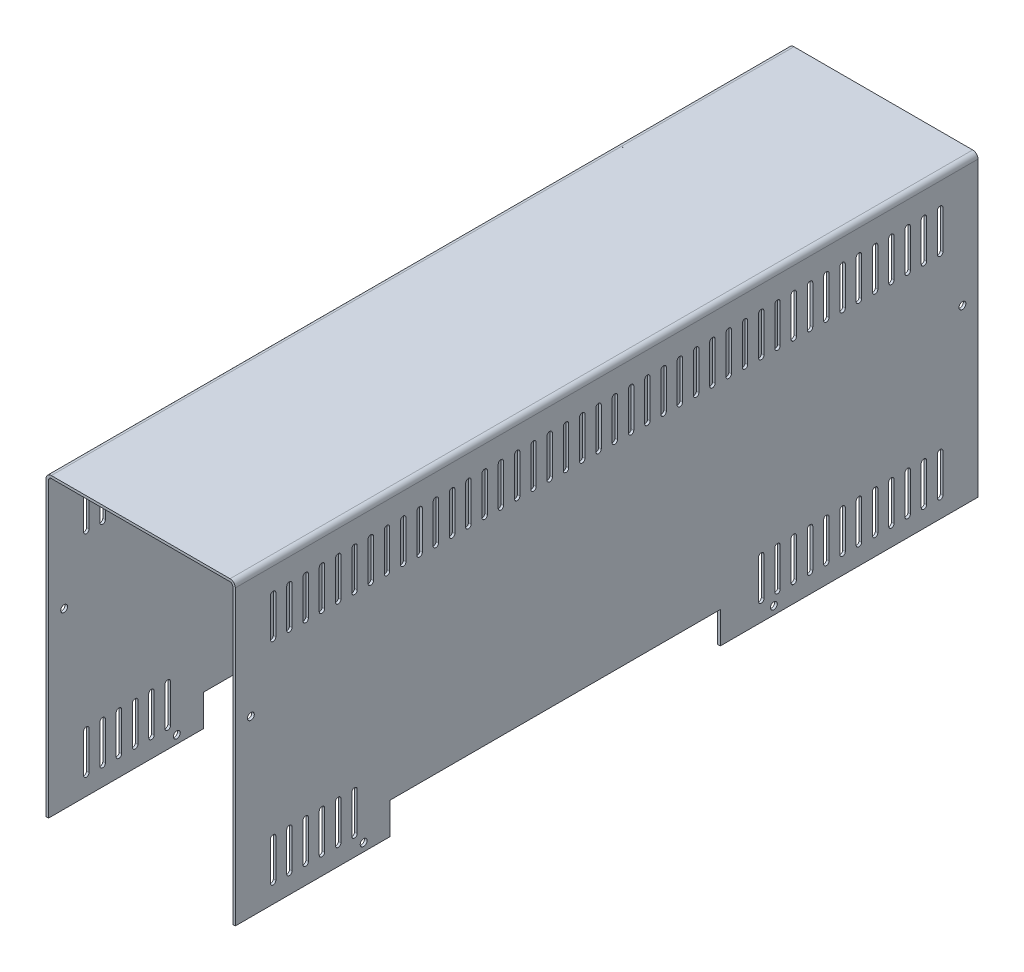
from build123d import *

# Parameters (mm, degrees)
BASE_FLANGE1_DEPTH      = 425.49
SKETCH6_W               = 193.4
SKETCH6_H               = 18.5
CUT_EXTRUDE1_DEPTH      = 473.550695799
CUT_EXTRUDE2_DEPTH      = 473.550695799
CUT_EXTRUDE2_DEPTH_BACK = 473.550695799
SKETCH7_R               = 2
CUT_EXTRUDE3_DEPTH      = 473.550695799
BOSS_EXTRUDE1_DEPTH     = 4.76
BOSS_EXTRUDE2_START     = 4.76
BOSS_EXTRUDE2_DEPTH     = 4.76


# Sheet-metal steps are written as plain solids
with BuildPart() as part:
    # Sketch1 → Base-Flange1 (new body)
    with BuildSketch(Plane.XY):
        with BuildLine():
            Line((0, -173.1), (0, -1.6))
            ThreePointArc((0, -1.6), (0.46862915, -0.46862915), (1.6, 0))
            Line((1.6, 0), (106.3, 0))
            ThreePointArc((106.3, 0), (107.43137085, -0.46862915), (107.9, -1.6))
            Line((107.9, -1.6), (107.9, -173.1))
            Line((107.9, -173.1), (109.4, -173.1))
            Line((109.4, -173.1), (109.4, -1.6))
            ThreePointArc((109.4, -1.6), (108.492031022, 0.592031022), (106.3, 1.5))
            Line((106.3, 1.5), (1.6, 1.5))
            ThreePointArc((1.6, 1.5), (-0.592031022, 0.592031022), (-1.5, -1.6))
            Line((-1.5, -1.6), (-1.5, -173.1))
            Line((-1.5, -173.1), (0, -173.1))
        make_face()
    extrude(amount=-BASE_FLANGE1_DEPTH)

    # Sketch6 → Cut-Extrude1 (cut, through all)
    with BuildSketch(Plane(origin=(109.4, 0, 0), x_dir=(0, 0, -1), z_dir=(1, 0, 0))):
        with Locations((182.6, -163.85)):
            Rectangle(SKETCH6_W, SKETCH6_H)
    extrude(amount=-CUT_EXTRUDE1_DEPTH, mode=Mode.SUBTRACT)

    # Sketch7 → Cut-Extrude2 (cut, two sides: drawn at the far end of the back side and taken through both)
    with BuildSketch(Plane(origin=(109.4, 0, 0), x_dir=(0, 0, -1), z_dir=(1, 0, 0)).offset(-CUT_EXTRUDE2_DEPTH_BACK)):
        with Locations(Location((421.14, -71.34, 0), (0, 0, 90))):
            Circle(SKETCH7_R)
        with Locations(Location((310.68, -168.38, 0), (0, 0, 90))):
            Circle(SKETCH7_R)
        with Locations(Location((70.39, -168.38, 0), (0, 0, 90))):
            Circle(SKETCH7_R)
        with Locations(Location((4.35, -71.34, 0), (0, 0, 90))):
            Circle(SKETCH7_R)
    extrude(amount=CUT_EXTRUDE2_DEPTH + CUT_EXTRUDE2_DEPTH_BACK, mode=Mode.SUBTRACT)

    # Sketch8 → Cut-Extrude3 (cut, through all)
    with BuildSketch(Plane(origin=(109.4, 0, 0), x_dir=(0, 0, -1), z_dir=(1, 0, 0))):
        with BuildLine():
            Line((18.975, -15.8875), (18.975, -38.2925))
            ThreePointArc((18.975, -38.2925), (17.3875, -39.88), (15.8, -38.2925))
            Line((15.8, -38.2925), (15.8, -15.8875))
            ThreePointArc((15.8, -15.8875), (17.3875, -14.3), (18.975, -15.8875))
        make_face()
        with BuildLine():
            Line((28.505, -15.8875), (28.505, -38.2925))
            ThreePointArc((28.505, -38.2925), (26.9175, -39.88), (25.33, -38.2925))
            Line((25.33, -38.2925), (25.33, -15.8875))
            ThreePointArc((25.33, -15.8875), (26.9175, -14.3), (28.505, -15.8875))
        make_face()
        with BuildLine():
            Line((38.035, -15.8875), (38.035, -38.2925))
            ThreePointArc((38.035, -38.2925), (36.4475, -39.88), (34.86, -38.2925))
            Line((34.86, -38.2925), (34.86, -15.8875))
            ThreePointArc((34.86, -15.8875), (36.4475, -14.3), (38.035, -15.8875))
        make_face()
        with BuildLine():
            Line((47.565, -15.8875), (47.565, -38.2925))
            ThreePointArc((47.565, -38.2925), (45.9775, -39.88), (44.39, -38.2925))
            Line((44.39, -38.2925), (44.39, -15.8875))
            ThreePointArc((44.39, -15.8875), (45.9775, -14.3), (47.565, -15.8875))
        make_face()
        with BuildLine():
            Line((57.095, -15.8875), (57.095, -38.2925))
            ThreePointArc((57.095, -38.2925), (55.5075, -39.88), (53.92, -38.2925))
            Line((53.92, -38.2925), (53.92, -15.8875))
            ThreePointArc((53.92, -15.8875), (55.5075, -14.3), (57.095, -15.8875))
        make_face()
        with BuildLine():
            Line((66.625, -15.8875), (66.625, -38.2925))
            ThreePointArc((66.625, -38.2925), (65.0375, -39.88), (63.45, -38.2925))
            Line((63.45, -38.2925), (63.45, -15.8875))
            ThreePointArc((63.45, -15.8875), (65.0375, -14.3), (66.625, -15.8875))
        make_face()
        with BuildLine():
            Line((76.155, -15.8875), (76.155, -38.2925))
            ThreePointArc((76.155, -38.2925), (74.5675, -39.88), (72.98, -38.2925))
            Line((72.98, -38.2925), (72.98, -15.8875))
            ThreePointArc((72.98, -15.8875), (74.5675, -14.3), (76.155, -15.8875))
        make_face()
        with BuildLine():
            Line((85.685, -15.8875), (85.685, -38.2925))
            ThreePointArc((85.685, -38.2925), (84.0975, -39.88), (82.51, -38.2925))
            Line((82.51, -38.2925), (82.51, -15.8875))
            ThreePointArc((82.51, -15.8875), (84.0975, -14.3), (85.685, -15.8875))
        make_face()
        with BuildLine():
            Line((95.215, -15.8875), (95.215, -38.2925))
            ThreePointArc((95.215, -38.2925), (93.6275, -39.88), (92.04, -38.2925))
            Line((92.04, -38.2925), (92.04, -15.8875))
            ThreePointArc((92.04, -15.8875), (93.6275, -14.3), (95.215, -15.8875))
        make_face()
        with BuildLine():
            Line((104.745, -15.8875), (104.745, -38.2925))
            ThreePointArc((104.745, -38.2925), (103.1575, -39.88), (101.57, -38.2925))
            Line((101.57, -38.2925), (101.57, -15.8875))
            ThreePointArc((101.57, -15.8875), (103.1575, -14.3), (104.745, -15.8875))
        make_face()
        with BuildLine():
            Line((114.275, -15.8875), (114.275, -38.2925))
            ThreePointArc((114.275, -38.2925), (112.6875, -39.88), (111.1, -38.2925))
            Line((111.1, -38.2925), (111.1, -15.8875))
            ThreePointArc((111.1, -15.8875), (112.6875, -14.3), (114.275, -15.8875))
        make_face()
        with BuildLine():
            Line((123.805, -15.8875), (123.805, -38.2925))
            ThreePointArc((123.805, -38.2925), (122.2175, -39.88), (120.63, -38.2925))
            Line((120.63, -38.2925), (120.63, -15.8875))
            ThreePointArc((120.63, -15.8875), (122.2175, -14.3), (123.805, -15.8875))
        make_face()
        with BuildLine():
            Line((133.335, -15.8875), (133.335, -38.2925))
            ThreePointArc((133.335, -38.2925), (131.7475, -39.88), (130.16, -38.2925))
            Line((130.16, -38.2925), (130.16, -15.8875))
            ThreePointArc((130.16, -15.8875), (131.7475, -14.3), (133.335, -15.8875))
        make_face()
        with BuildLine():
            Line((142.865, -15.8875), (142.865, -38.2925))
            ThreePointArc((142.865, -38.2925), (141.2775, -39.88), (139.69, -38.2925))
            Line((139.69, -38.2925), (139.69, -15.8875))
            ThreePointArc((139.69, -15.8875), (141.2775, -14.3), (142.865, -15.8875))
        make_face()
        with BuildLine():
            Line((152.395, -15.8875), (152.395, -38.2925))
            ThreePointArc((152.395, -38.2925), (150.8075, -39.88), (149.22, -38.2925))
            Line((149.22, -38.2925), (149.22, -15.8875))
            ThreePointArc((149.22, -15.8875), (150.8075, -14.3), (152.395, -15.8875))
        make_face()
        with BuildLine():
            Line((161.925, -15.8875), (161.925, -38.2925))
            ThreePointArc((161.925, -38.2925), (160.3375, -39.88), (158.75, -38.2925))
            Line((158.75, -38.2925), (158.75, -15.8875))
            ThreePointArc((158.75, -15.8875), (160.3375, -14.3), (161.925, -15.8875))
        make_face()
        with BuildLine():
            Line((171.455, -15.8875), (171.455, -38.2925))
            ThreePointArc((171.455, -38.2925), (169.8675, -39.88), (168.28, -38.2925))
            Line((168.28, -38.2925), (168.28, -15.8875))
            ThreePointArc((168.28, -15.8875), (169.8675, -14.3), (171.455, -15.8875))
        make_face()
        with BuildLine():
            Line((180.985, -15.8875), (180.985, -38.2925))
            ThreePointArc((180.985, -38.2925), (179.3975, -39.88), (177.81, -38.2925))
            Line((177.81, -38.2925), (177.81, -15.8875))
            ThreePointArc((177.81, -15.8875), (179.3975, -14.3), (180.985, -15.8875))
        make_face()
        with BuildLine():
            Line((190.515, -15.8875), (190.515, -38.2925))
            ThreePointArc((190.515, -38.2925), (188.9275, -39.88), (187.34, -38.2925))
            Line((187.34, -38.2925), (187.34, -15.8875))
            ThreePointArc((187.34, -15.8875), (188.9275, -14.3), (190.515, -15.8875))
        make_face()
        with BuildLine():
            Line((200.045, -15.8875), (200.045, -38.2925))
            ThreePointArc((200.045, -38.2925), (198.4575, -39.88), (196.87, -38.2925))
            Line((196.87, -38.2925), (196.87, -15.8875))
            ThreePointArc((196.87, -15.8875), (198.4575, -14.3), (200.045, -15.8875))
        make_face()
        with BuildLine():
            Line((209.575, -15.8875), (209.575, -38.2925))
            ThreePointArc((209.575, -38.2925), (207.9875, -39.88), (206.4, -38.2925))
            Line((206.4, -38.2925), (206.4, -15.8875))
            ThreePointArc((206.4, -15.8875), (207.9875, -14.3), (209.575, -15.8875))
        make_face()
        with BuildLine():
            Line((219.105, -15.8875), (219.105, -38.2925))
            ThreePointArc((219.105, -38.2925), (217.5175, -39.88), (215.93, -38.2925))
            Line((215.93, -38.2925), (215.93, -15.8875))
            ThreePointArc((215.93, -15.8875), (217.5175, -14.3), (219.105, -15.8875))
        make_face()
        with BuildLine():
            Line((228.635, -15.8875), (228.635, -38.2925))
            ThreePointArc((228.635, -38.2925), (227.0475, -39.88), (225.46, -38.2925))
            Line((225.46, -38.2925), (225.46, -15.8875))
            ThreePointArc((225.46, -15.8875), (227.0475, -14.3), (228.635, -15.8875))
        make_face()
        with BuildLine():
            Line((238.165, -15.8875), (238.165, -38.2925))
            ThreePointArc((238.165, -38.2925), (236.5775, -39.88), (234.99, -38.2925))
            Line((234.99, -38.2925), (234.99, -15.8875))
            ThreePointArc((234.99, -15.8875), (236.5775, -14.3), (238.165, -15.8875))
        make_face()
        with BuildLine():
            Line((247.695, -15.8875), (247.695, -38.2925))
            ThreePointArc((247.695, -38.2925), (246.1075, -39.88), (244.52, -38.2925))
            Line((244.52, -38.2925), (244.52, -15.8875))
            ThreePointArc((244.52, -15.8875), (246.1075, -14.3), (247.695, -15.8875))
        make_face()
        with BuildLine():
            Line((257.225, -15.8875), (257.225, -38.2925))
            ThreePointArc((257.225, -38.2925), (255.6375, -39.88), (254.05, -38.2925))
            Line((254.05, -38.2925), (254.05, -15.8875))
            ThreePointArc((254.05, -15.8875), (255.6375, -14.3), (257.225, -15.8875))
        make_face()
        with BuildLine():
            Line((266.755, -15.8875), (266.755, -38.2925))
            ThreePointArc((266.755, -38.2925), (265.1675, -39.88), (263.58, -38.2925))
            Line((263.58, -38.2925), (263.58, -15.8875))
            ThreePointArc((263.58, -15.8875), (265.1675, -14.3), (266.755, -15.8875))
        make_face()
        with BuildLine():
            Line((276.285, -15.8875), (276.285, -38.2925))
            ThreePointArc((276.285, -38.2925), (274.6975, -39.88), (273.11, -38.2925))
            Line((273.11, -38.2925), (273.11, -15.8875))
            ThreePointArc((273.11, -15.8875), (274.6975, -14.3), (276.285, -15.8875))
        make_face()
        with BuildLine():
            Line((285.815, -15.8875), (285.815, -38.2925))
            ThreePointArc((285.815, -38.2925), (284.2275, -39.88), (282.64, -38.2925))
            Line((282.64, -38.2925), (282.64, -15.8875))
            ThreePointArc((282.64, -15.8875), (284.2275, -14.3), (285.815, -15.8875))
        make_face()
        with BuildLine():
            Line((295.345, -15.8875), (295.345, -38.2925))
            ThreePointArc((295.345, -38.2925), (293.7575, -39.88), (292.17, -38.2925))
            Line((292.17, -38.2925), (292.17, -15.8875))
            ThreePointArc((292.17, -15.8875), (293.7575, -14.3), (295.345, -15.8875))
        make_face()
        with BuildLine():
            Line((304.875, -15.8875), (304.875, -38.2925))
            ThreePointArc((304.875, -38.2925), (303.2875, -39.88), (301.7, -38.2925))
            Line((301.7, -38.2925), (301.7, -15.8875))
            ThreePointArc((301.7, -15.8875), (303.2875, -14.3), (304.875, -15.8875))
        make_face()
        with BuildLine():
            Line((314.405, -15.8875), (314.405, -38.2925))
            ThreePointArc((314.405, -38.2925), (312.8175, -39.88), (311.23, -38.2925))
            Line((311.23, -38.2925), (311.23, -15.8875))
            ThreePointArc((311.23, -15.8875), (312.8175, -14.3), (314.405, -15.8875))
        make_face()
        with BuildLine():
            Line((323.935, -15.8875), (323.935, -38.2925))
            ThreePointArc((323.935, -38.2925), (322.3475, -39.88), (320.76, -38.2925))
            Line((320.76, -38.2925), (320.76, -15.8875))
            ThreePointArc((320.76, -15.8875), (322.3475, -14.3), (323.935, -15.8875))
        make_face()
        with BuildLine():
            Line((333.465, -15.8875), (333.465, -38.2925))
            ThreePointArc((333.465, -38.2925), (331.8775, -39.88), (330.29, -38.2925))
            Line((330.29, -38.2925), (330.29, -15.8875))
            ThreePointArc((330.29, -15.8875), (331.8775, -14.3), (333.465, -15.8875))
        make_face()
        with BuildLine():
            Line((342.995, -15.8875), (342.995, -38.2925))
            ThreePointArc((342.995, -38.2925), (341.4075, -39.88), (339.82, -38.2925))
            Line((339.82, -38.2925), (339.82, -15.8875))
            ThreePointArc((339.82, -15.8875), (341.4075, -14.3), (342.995, -15.8875))
        make_face()
        with BuildLine():
            Line((352.525, -15.8875), (352.525, -38.2925))
            ThreePointArc((352.525, -38.2925), (350.9375, -39.88), (349.35, -38.2925))
            Line((349.35, -38.2925), (349.35, -15.8875))
            ThreePointArc((349.35, -15.8875), (350.9375, -14.3), (352.525, -15.8875))
        make_face()
        with BuildLine():
            Line((362.055, -15.8875), (362.055, -38.2925))
            ThreePointArc((362.055, -38.2925), (360.4675, -39.88), (358.88, -38.2925))
            Line((358.88, -38.2925), (358.88, -15.8875))
            ThreePointArc((358.88, -15.8875), (360.4675, -14.3), (362.055, -15.8875))
        make_face()
        with BuildLine():
            Line((371.585, -15.8875), (371.585, -38.2925))
            ThreePointArc((371.585, -38.2925), (369.9975, -39.88), (368.41, -38.2925))
            Line((368.41, -38.2925), (368.41, -15.8875))
            ThreePointArc((368.41, -15.8875), (369.9975, -14.3), (371.585, -15.8875))
        make_face()
        with BuildLine():
            Line((381.115, -15.8875), (381.115, -38.2925))
            ThreePointArc((381.115, -38.2925), (379.5275, -39.88), (377.94, -38.2925))
            Line((377.94, -38.2925), (377.94, -15.8875))
            ThreePointArc((377.94, -15.8875), (379.5275, -14.3), (381.115, -15.8875))
        make_face()
        with BuildLine():
            Line((390.645, -15.8875), (390.645, -38.2925))
            ThreePointArc((390.645, -38.2925), (389.0575, -39.88), (387.47, -38.2925))
            Line((387.47, -38.2925), (387.47, -15.8875))
            ThreePointArc((387.47, -15.8875), (389.0575, -14.3), (390.645, -15.8875))
        make_face()
        with BuildLine():
            Line((400.175, -15.8875), (400.175, -38.2925))
            ThreePointArc((400.175, -38.2925), (398.5875, -39.88), (397, -38.2925))
            Line((397, -38.2925), (397, -15.8875))
            ThreePointArc((397, -15.8875), (398.5875, -14.3), (400.175, -15.8875))
        make_face()
        with BuildLine():
            Line((409.705, -15.8875), (409.705, -38.2925))
            ThreePointArc((409.705, -38.2925), (408.1175, -39.88), (406.53, -38.2925))
            Line((406.53, -38.2925), (406.53, -15.8875))
            ThreePointArc((406.53, -15.8875), (408.1175, -14.3), (409.705, -15.8875))
        make_face()
        with BuildLine():
            Line((18.975, -139.4075), (18.975, -161.8125))
            ThreePointArc((18.975, -161.8125), (17.3875, -163.4), (15.8, -161.8125))
            Line((15.8, -161.8125), (15.8, -139.4075))
            ThreePointArc((15.8, -139.4075), (17.3875, -137.82), (18.975, -139.4075))
        make_face()
        with BuildLine():
            Line((28.505, -139.4075), (28.505, -161.8125))
            ThreePointArc((28.505, -161.8125), (26.9175, -163.4), (25.33, -161.8125))
            Line((25.33, -161.8125), (25.33, -139.4075))
            ThreePointArc((25.33, -139.4075), (26.9175, -137.82), (28.505, -139.4075))
        make_face()
        with BuildLine():
            Line((38.035, -139.4075), (38.035, -161.8125))
            ThreePointArc((38.035, -161.8125), (36.4475, -163.4), (34.86, -161.8125))
            Line((34.86, -161.8125), (34.86, -139.4075))
            ThreePointArc((34.86, -139.4075), (36.4475, -137.82), (38.035, -139.4075))
        make_face()
        with BuildLine():
            Line((47.565, -139.4075), (47.565, -161.8125))
            ThreePointArc((47.565, -161.8125), (45.9775, -163.4), (44.39, -161.8125))
            Line((44.39, -161.8125), (44.39, -139.4075))
            ThreePointArc((44.39, -139.4075), (45.9775, -137.82), (47.565, -139.4075))
        make_face()
        with BuildLine():
            Line((57.095, -139.4075), (57.095, -161.8125))
            ThreePointArc((57.095, -161.8125), (55.5075, -163.4), (53.92, -161.8125))
            Line((53.92, -161.8125), (53.92, -139.4075))
            ThreePointArc((53.92, -139.4075), (55.5075, -137.82), (57.095, -139.4075))
        make_face()
        with BuildLine():
            Line((66.625, -139.4075), (66.625, -161.8125))
            ThreePointArc((66.625, -161.8125), (65.0375, -163.4), (63.45, -161.8125))
            Line((63.45, -161.8125), (63.45, -139.4075))
            ThreePointArc((63.45, -139.4075), (65.0375, -137.82), (66.625, -139.4075))
        make_face()
        with BuildLine():
            Line((304.875, -139.4075), (304.875, -161.8125))
            ThreePointArc((304.875, -161.8125), (303.2875, -163.4), (301.7, -161.8125))
            Line((301.7, -161.8125), (301.7, -139.4075))
            ThreePointArc((301.7, -139.4075), (303.2875, -137.82), (304.875, -139.4075))
        make_face()
        with BuildLine():
            Line((314.405, -139.4075), (314.405, -161.8125))
            ThreePointArc((314.405, -161.8125), (312.8175, -163.4), (311.23, -161.8125))
            Line((311.23, -161.8125), (311.23, -139.4075))
            ThreePointArc((311.23, -139.4075), (312.8175, -137.82), (314.405, -139.4075))
        make_face()
        with BuildLine():
            Line((323.935, -139.4075), (323.935, -161.8125))
            ThreePointArc((323.935, -161.8125), (322.3475, -163.4), (320.76, -161.8125))
            Line((320.76, -161.8125), (320.76, -139.4075))
            ThreePointArc((320.76, -139.4075), (322.3475, -137.82), (323.935, -139.4075))
        make_face()
        with BuildLine():
            Line((333.465, -139.4075), (333.465, -161.8125))
            ThreePointArc((333.465, -161.8125), (331.8775, -163.4), (330.29, -161.8125))
            Line((330.29, -161.8125), (330.29, -139.4075))
            ThreePointArc((330.29, -139.4075), (331.8775, -137.82), (333.465, -139.4075))
        make_face()
        with BuildLine():
            Line((342.995, -139.4075), (342.995, -161.8125))
            ThreePointArc((342.995, -161.8125), (341.4075, -163.4), (339.82, -161.8125))
            Line((339.82, -161.8125), (339.82, -139.4075))
            ThreePointArc((339.82, -139.4075), (341.4075, -137.82), (342.995, -139.4075))
        make_face()
        with BuildLine():
            Line((352.525, -139.4075), (352.525, -161.8125))
            ThreePointArc((352.525, -161.8125), (350.9375, -163.4), (349.35, -161.8125))
            Line((349.35, -161.8125), (349.35, -139.4075))
            ThreePointArc((349.35, -139.4075), (350.9375, -137.82), (352.525, -139.4075))
        make_face()
        with BuildLine():
            Line((362.055, -139.4075), (362.055, -161.8125))
            ThreePointArc((362.055, -161.8125), (360.4675, -163.4), (358.88, -161.8125))
            Line((358.88, -161.8125), (358.88, -139.4075))
            ThreePointArc((358.88, -139.4075), (360.4675, -137.82), (362.055, -139.4075))
        make_face()
        with BuildLine():
            Line((371.585, -139.4075), (371.585, -161.8125))
            ThreePointArc((371.585, -161.8125), (369.9975, -163.4), (368.41, -161.8125))
            Line((368.41, -161.8125), (368.41, -139.4075))
            ThreePointArc((368.41, -139.4075), (369.9975, -137.82), (371.585, -139.4075))
        make_face()
        with BuildLine():
            Line((381.115, -139.4075), (381.115, -161.8125))
            ThreePointArc((381.115, -161.8125), (379.5275, -163.4), (377.94, -161.8125))
            Line((377.94, -161.8125), (377.94, -139.4075))
            ThreePointArc((377.94, -139.4075), (379.5275, -137.82), (381.115, -139.4075))
        make_face()
        with BuildLine():
            Line((390.645, -139.4075), (390.645, -161.8125))
            ThreePointArc((390.645, -161.8125), (389.0575, -163.4), (387.47, -161.8125))
            Line((387.47, -161.8125), (387.47, -139.4075))
            ThreePointArc((387.47, -139.4075), (389.0575, -137.82), (390.645, -139.4075))
        make_face()
        with BuildLine():
            Line((400.175, -139.4075), (400.175, -161.8125))
            ThreePointArc((400.175, -161.8125), (398.5875, -163.4), (397, -161.8125))
            Line((397, -161.8125), (397, -139.4075))
            ThreePointArc((397, -139.4075), (398.5875, -137.82), (400.175, -139.4075))
        make_face()
        with BuildLine():
            Line((409.705, -139.4075), (409.705, -161.8125))
            ThreePointArc((409.705, -161.8125), (408.1175, -163.4), (406.53, -161.8125))
            Line((406.53, -161.8125), (406.53, -139.4075))
            ThreePointArc((406.53, -139.4075), (408.1175, -137.82), (409.705, -139.4075))
        make_face()
    extrude(amount=-CUT_EXTRUDE3_DEPTH, mode=Mode.SUBTRACT)

    # Sketch9 → Boss-Extrude1 (add)
    with BuildSketch(Plane(origin=(0, 0, -425.49), x_dir=(-1, 0, 0), z_dir=(0, 0, -1))):
        with BuildLine():
            Line((1.5, -173.1), (1.5, -1.6))
            ThreePointArc((1.5, -1.6), (0.592031022, 0.592031022), (-1.6, 1.5))
            Line((-1.6, 1.5), (-106.3, 1.5))
            ThreePointArc((-106.3, 1.5), (-108.492031022, 0.592031022), (-109.4, -1.6))
            Line((-109.4, -1.6), (-109.4, -173.1))
            Line((-109.4, -173.1), (-107.9, -173.1))
            Line((-107.9, -173.1), (-107.9, -1.6))
            ThreePointArc((-107.9, -1.6), (-107.43137085, -0.46862915), (-106.3, 0))
            Line((-106.3, 0), (-1.6, 0))
            ThreePointArc((-1.6, 0), (-0.46862915, -0.46862915), (0, -1.6))
            Line((0, -1.6), (0, -173.1))
            Line((0, -173.1), (1.5, -173.1))
        make_face()
    extrude(amount=BOSS_EXTRUDE1_DEPTH)

    # Sketch11 → Boss-Extrude2 (add)
    with BuildSketch(Plane.XY.offset(BOSS_EXTRUDE2_START)):
        with BuildLine():
            Line((109.4, -173.1), (109.4, -1.6))
            ThreePointArc((109.4, -1.6), (108.492031022, 0.592031022), (106.3, 1.5))
            Line((106.3, 1.5), (1.6, 1.5))
            ThreePointArc((1.6, 1.5), (-0.592031022, 0.592031022), (-1.5, -1.6))
            Line((-1.5, -1.6), (-1.5, -173.1))
            Line((-1.5, -173.1), (0, -173.1))
            Line((0, -173.1), (0, -1.6))
            ThreePointArc((0, -1.6), (0.46862915, -0.46862915), (1.6, 0))
            Line((1.6, 0), (106.3, 0))
            ThreePointArc((106.3, 0), (107.43137085, -0.46862915), (107.9, -1.6))
            Line((107.9, -1.6), (107.9, -173.1))
            Line((107.9, -173.1), (109.4, -173.1))
        make_face()
    extrude(amount=-BOSS_EXTRUDE2_DEPTH)


solid = part.part
